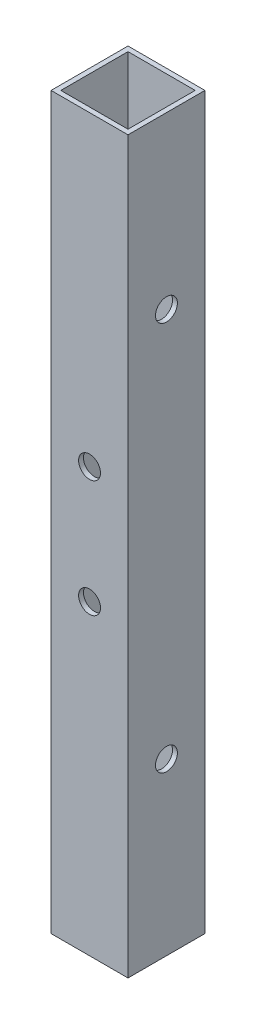
from build123d import *

# Parameters (mm, degrees)
SKETCH1_W           = 15.8
SKETCH1_H           = 15.8
SKETCH1_W_2         = 13.8
SKETCH1_H_2         = 13.8
BOSS_EXTRUDE1_DEPTH = 150
SKETCH2_R           = 2.25
CUT_EXTRUDE1_DEPTH  = 152.036584972
SKETCH3_R           = 2.25
CUT_EXTRUDE3_DEPTH  = 152.036584972


with BuildPart() as part:
    # Sketch1 → Boss-Extrude1 (new body)
    with BuildSketch(Plane(origin=(0, 0, 0), x_dir=(1, 0, 0), z_dir=(0, 1, 0))):
        Rectangle(SKETCH1_W, SKETCH1_H)
        Rectangle(SKETCH1_W_2, SKETCH1_H_2, mode=Mode.SUBTRACT)
    extrude(amount=BOSS_EXTRUDE1_DEPTH)

    # Sketch2 → Cut-Extrude1 (cut, through all)
    with BuildSketch(Plane.ZY.offset(7.9)):
        with Locations((0, 115)):
            Circle(SKETCH2_R)
        with Locations((0, 35)):
            Circle(SKETCH2_R)
    extrude(amount=-CUT_EXTRUDE1_DEPTH, mode=Mode.SUBTRACT)

    # Sketch3 → Cut-Extrude3 (cut, through all)
    with BuildSketch(Plane.XY.offset(7.9)):
        with Locations((0, 87)):
            Circle(SKETCH3_R)
        with Locations((0, 63)):
            Circle(SKETCH3_R)
    extrude(amount=-CUT_EXTRUDE3_DEPTH, mode=Mode.SUBTRACT)


solid = part.part
